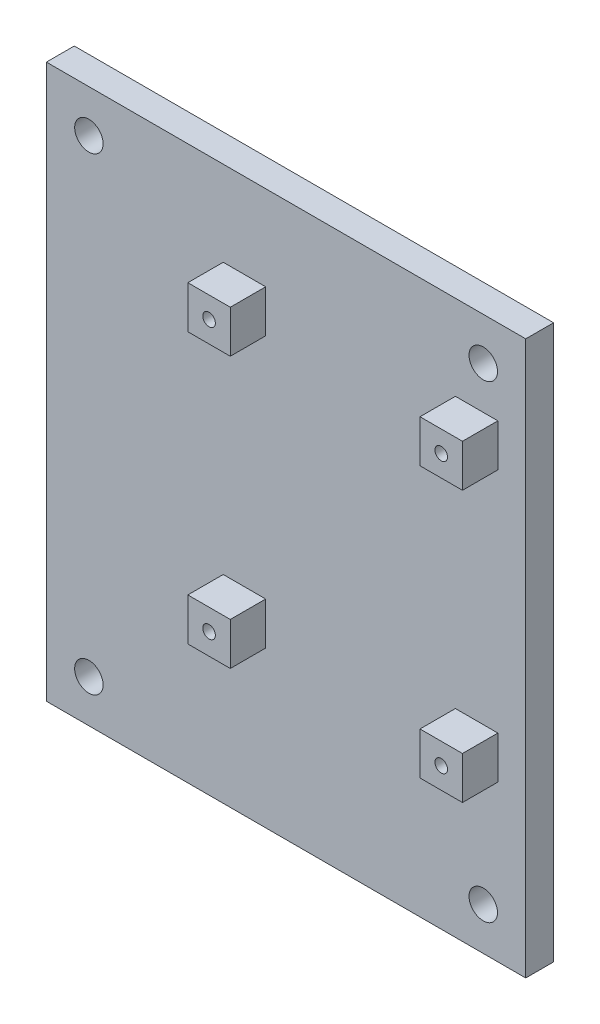
from build123d import *

# Parameters (mm, degrees)
SKETCH1_W                 = 85.999999704
SKETCH1_H                 = 99.314
BOSS_EXTRUDE1_DEPTH       = 4.999999906
SKETCH2_W                 = 7.62
SKETCH2_H                 = 7.62
BOSS_EXTRUDE2_DEPTH       = 6.35
F_4_40_TAPPED_HOLE1_D     = 2.2606
F_4_40_TAPPED_HOLE1_DEPTH = 4.7498
F_4_40_TAPPED_HOLE1_TIP   = 0.679152758
F_10_CLEARANCE_HOLE1_D    = 5.1054


with BuildPart() as part:
    # Sketch1 → Boss-Extrude1 (new body)
    with BuildSketch(Plane.XY):
        Rectangle(SKETCH1_W, SKETCH1_H)
    extrude(amount=BOSS_EXTRUDE1_DEPTH)

    # Sketch2 → Boss-Extrude2 (add)
    with BuildSketch(Plane.XY.offset(4.999999906)):
        with Locations((-7.466000054, 30.607)):
            Rectangle(SKETCH2_W, SKETCH2_H)
        with Locations((34.189999946, 30.607)):
            Rectangle(SKETCH2_W, SKETCH2_H)
        with Locations((-7.466000054, -17.907)):
            Rectangle(SKETCH2_W, SKETCH2_H)
        with Locations((34.189999946, -17.907)):
            Rectangle(SKETCH2_W, SKETCH2_H)
    extrude(amount=BOSS_EXTRUDE2_DEPTH)

    # #4-40 Tapped Hole1
    with Locations(Plane.XY.offset(11.349999906)):
        with Locations((-7.466000054, 30.607), (34.189999946, 30.607), (-7.466000054, -17.907), (34.189999946, -17.907)):
            Hole(F_4_40_TAPPED_HOLE1_D / 2, depth=F_4_40_TAPPED_HOLE1_DEPTH)
            with Locations((0, 0, -(F_4_40_TAPPED_HOLE1_DEPTH + F_4_40_TAPPED_HOLE1_TIP / 2))):  # 118° drill point
                Cone(0, F_4_40_TAPPED_HOLE1_D / 2, F_4_40_TAPPED_HOLE1_TIP, mode=Mode.SUBTRACT)

    # #10 Clearance Hole1 (through all)
    with Locations(Plane.XY.offset(4.999999906)):
        with Locations((-35.379999852, 42.037), (35.379999852, 42.037), (-35.379999852, -42.037), (35.379999852, -42.037)):
            Hole(F_10_CLEARANCE_HOLE1_D / 2)


solid = part.part
